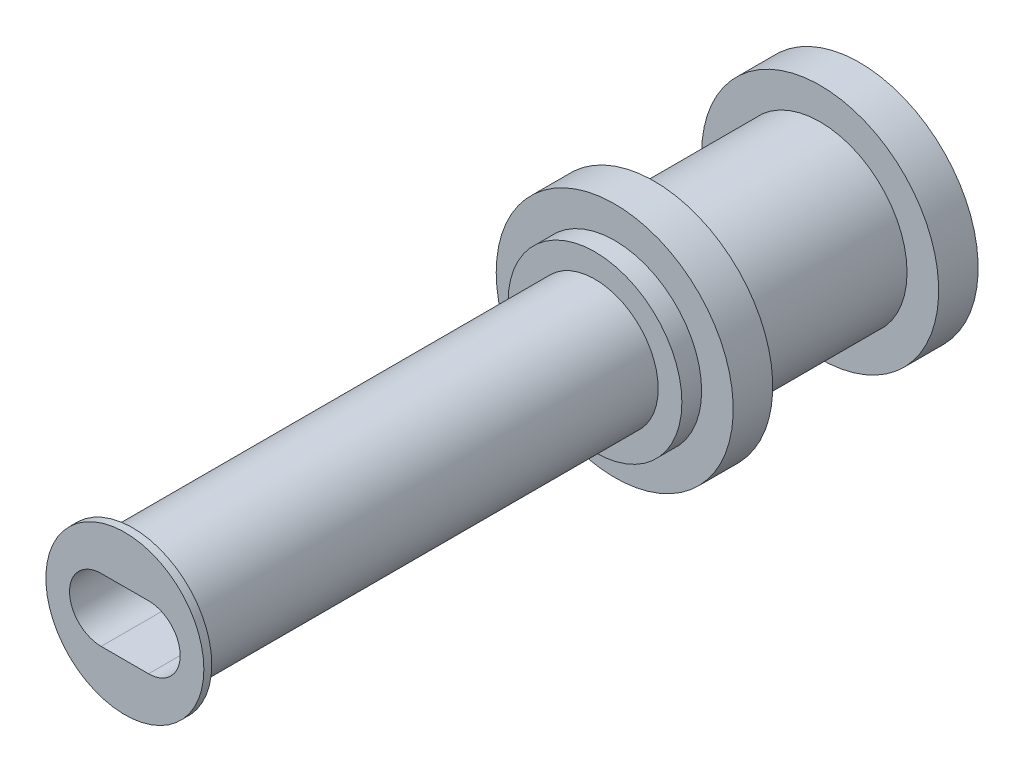
from build123d import *

# Parameters (mm, degrees)
SKETCH1_R           = 2.794
BOSS_EXTRUDE1_DEPTH = 3.937
SKETCH2_R           = 3.81
SKETCH2_R_2         = 2.794
BOSS_EXTRUDE2_DEPTH = 1.27
SKETCH3_R           = 2.794
BOSS_EXTRUDE3_DEPTH = 0.635
SKETCH4_R           = 2.032
BOSS_EXTRUDE4_DEPTH = 15.113
BOSS_EXTRUDE5_START = -0.254
SKETCH5_R           = 2.54
SKETCH5_R_2         = 2.032
BOSS_EXTRUDE5_DEPTH = 0.254
CUT_EXTRUDE1_DEPTH  = 15.24


with BuildPart() as part:
    # Sketch1 → Boss-Extrude1 (new body)
    with BuildSketch(Plane.XY):
        with Locations((7.874, 0)):
            Circle(SKETCH1_R)
        with BuildLine():
            Line((6.35, 0.762), (7.112, 0.762))
            Line((7.112, 0.762), (7.112, 1.524))
            ThreePointArc((7.112, 1.524), (7.874, 2.286), (8.636, 1.524))
            Line((8.636, 1.524), (8.636, 0.762))
            Line((8.636, 0.762), (9.398, 0.762))
            ThreePointArc((9.398, 0.762), (10.16, 0), (9.398, -0.762))
            Line((9.398, -0.762), (8.636, -0.762))
            Line((8.636, -0.762), (8.636, -1.524))
            ThreePointArc((8.636, -1.524), (7.874, -2.286), (7.112, -1.524))
            Line((7.112, -1.524), (7.112, -0.762))
            Line((7.112, -0.762), (6.35, -0.762))
            ThreePointArc((6.35, -0.762), (5.588, 0), (6.35, 0.762))
        make_face(mode=Mode.SUBTRACT)
    boss_extrude1 = extrude(amount=BOSS_EXTRUDE1_DEPTH)

    # Sketch2 → Boss-Extrude2 (add)
    with BuildSketch(Plane(origin=(0, 0, 0), x_dir=(-1, 0, 0), z_dir=(0, 0, -1))):
        with Locations((-7.874, 0)):
            Circle(SKETCH2_R)
        with Locations((-7.874, 0)):
            Circle(SKETCH2_R_2, mode=Mode.SUBTRACT)
    boss_extrude2 = extrude(amount=-BOSS_EXTRUDE2_DEPTH)

    # Mirror1: Boss-Extrude1, Boss-Extrude2 across plane
    add(boss_extrude1.mirror(Plane.XY.offset(3.937)))
    add(boss_extrude2.mirror(Plane.XY.offset(3.937)))

    # Sketch3 → Boss-Extrude3 (add)
    with BuildSketch(Plane.XY.offset(7.874)):
        with Locations((7.874, 0)):
            Circle(SKETCH3_R)
    extrude(amount=BOSS_EXTRUDE3_DEPTH)

    # Sketch4 → Boss-Extrude4 (add)
    with BuildSketch(Plane.XY.offset(8.509)):
        with Locations((7.874, 0)):
            Circle(SKETCH4_R)
    extrude(amount=BOSS_EXTRUDE4_DEPTH)

    # Sketch5 → Boss-Extrude5 (add)
    with BuildSketch(Plane.XY.offset(23.622).offset(BOSS_EXTRUDE5_START)):
        with Locations((7.874, 0)):
            Circle(SKETCH5_R)
        with Locations((7.874, 0)):
            Circle(SKETCH5_R_2, mode=Mode.SUBTRACT)
    extrude(amount=BOSS_EXTRUDE5_DEPTH)

    # Sketch6 → Cut-Extrude1 (cut)
    with BuildSketch(Plane.XY.offset(23.622)):
        with BuildLine():
            Line((8.636, -1.016), (7.112, -1.016))
            ThreePointArc((7.112, -1.016), (6.096, 0), (7.112, 1.016))
            Line((7.112, 1.016), (8.636, 1.016))
            ThreePointArc((8.636, 1.016), (9.652, 0), (8.636, -1.016))
        make_face()
    extrude(amount=-CUT_EXTRUDE1_DEPTH, mode=Mode.SUBTRACT)


solid = part.part
